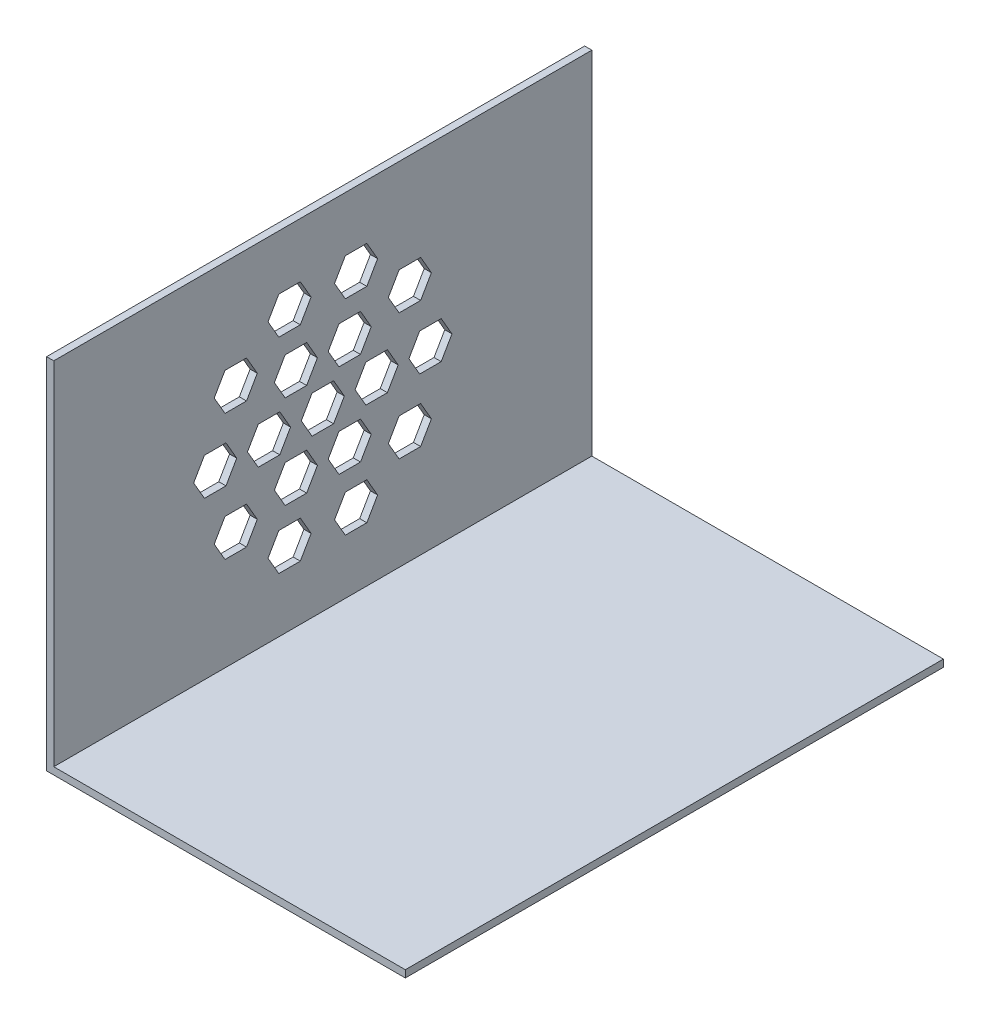
from build123d import *

# Parameters (mm, degrees)
BOSS_EXTRUDE1_DEPTH = 150
FILL_PATTERN1_DEPTH = 2


# Read off the part's stored shape, not the designer's step: Fill Pattern1
with BuildPart() as part:
    # Sketch1 → Boss-Extrude1 (new body)
    with BuildSketch(Plane.XY):
        Polygon((0, 0), (100, 0), (100, 2), (2, 2), (2, 100), (0, 100), align=None)
    extrude(amount=BOSS_EXTRUDE1_DEPTH)

    # Fill Pattern1 outline → Fill Pattern1 (cut)
    with BuildSketch(Plane.YZ):
        Polygon((51, 81), (45.803847577, 78), (45.803847577, 72), (51, 69), (56.196152423, 72), (56.196152423, 78), align=None)
        Polygon((63.990381057, 88.5), (58.794228634, 85.5), (58.794228634, 79.5), (63.990381057, 76.5), (69.186533479, 79.5), (69.186533479, 85.5), align=None)
        Polygon((38.009618943, 73.5), (32.813466521, 70.5), (32.813466521, 64.5), (38.009618943, 61.5), (43.205771366, 64.5), (43.205771366, 70.5), align=None)
        Polygon((45.803847577, 63), (45.803847577, 57), (51, 54), (56.196152423, 57), (56.196152423, 63), (51, 66), align=None)
        Polygon((45.803847577, 108), (45.803847577, 102), (51, 99), (56.196152423, 102), (56.196152423, 108), (51, 111), align=None)
        Polygon((45.803847577, 93), (45.803847577, 87), (51, 84), (56.196152423, 87), (56.196152423, 93), (51, 96), align=None)
        Polygon((45.803847577, 48), (45.803847577, 42), (51, 39), (56.196152423, 42), (56.196152423, 48), (51, 51), align=None)
        Polygon((58.794228634, 64.5), (63.990381057, 61.5), (69.186533479, 64.5), (69.186533479, 70.5), (63.990381057, 73.5), (58.794228634, 70.5), align=None)
        Polygon((32.813466521, 79.5), (38.009618943, 76.5), (43.205771366, 79.5), (43.205771366, 85.5), (38.009618943, 88.5), (32.813466521, 85.5), align=None)
        Polygon((79.531695489, 90.270509831), (74.335543066, 87.270509831), (74.335543066, 81.270509831), (79.531695489, 78.270509831), (84.727847912, 81.270509831), (84.727847912, 87.270509831), align=None)
        Polygon((74.335543066, 68.729490169), (74.335543066, 62.729490169), (79.531695489, 59.729490169), (84.727847912, 62.729490169), (84.727847912, 68.729490169), (79.531695489, 71.729490169), align=None)
        Polygon((68.633557569, 105.270509831), (63.437405146, 102.270509831), (63.437405146, 96.270509831), (68.633557569, 93.270509831), (73.829709991, 96.270509831), (73.829709991, 102.270509831), align=None)
        Polygon((63.437405146, 53.729490169), (63.437405146, 47.729490169), (68.633557569, 44.729490169), (73.829709991, 47.729490169), (73.829709991, 53.729490169), (68.633557569, 56.729490169), align=None)
        Polygon((33.366442431, 105.270509831), (28.170290009, 102.270509831), (28.170290009, 96.270509831), (33.366442431, 93.270509831), (38.562594854, 96.270509831), (38.562594854, 102.270509831), align=None)
        Polygon((28.170290009, 53.729490169), (28.170290009, 47.729490169), (33.366442431, 44.729490169), (38.562594854, 47.729490169), (38.562594854, 53.729490169), (33.366442431, 56.729490169), align=None)
        Polygon((22.468304511, 90.270509831), (17.272152088, 87.270509831), (17.272152088, 81.270509831), (22.468304511, 78.270509831), (27.664456934, 81.270509831), (27.664456934, 87.270509831), align=None)
        Polygon((17.272152088, 68.729490169), (17.272152088, 62.729490169), (22.468304511, 59.729490169), (27.664456934, 62.729490169), (27.664456934, 68.729490169), (22.468304511, 71.729490169), align=None)
    extrude(amount=FILL_PATTERN1_DEPTH, mode=Mode.SUBTRACT)


solid = part.part
